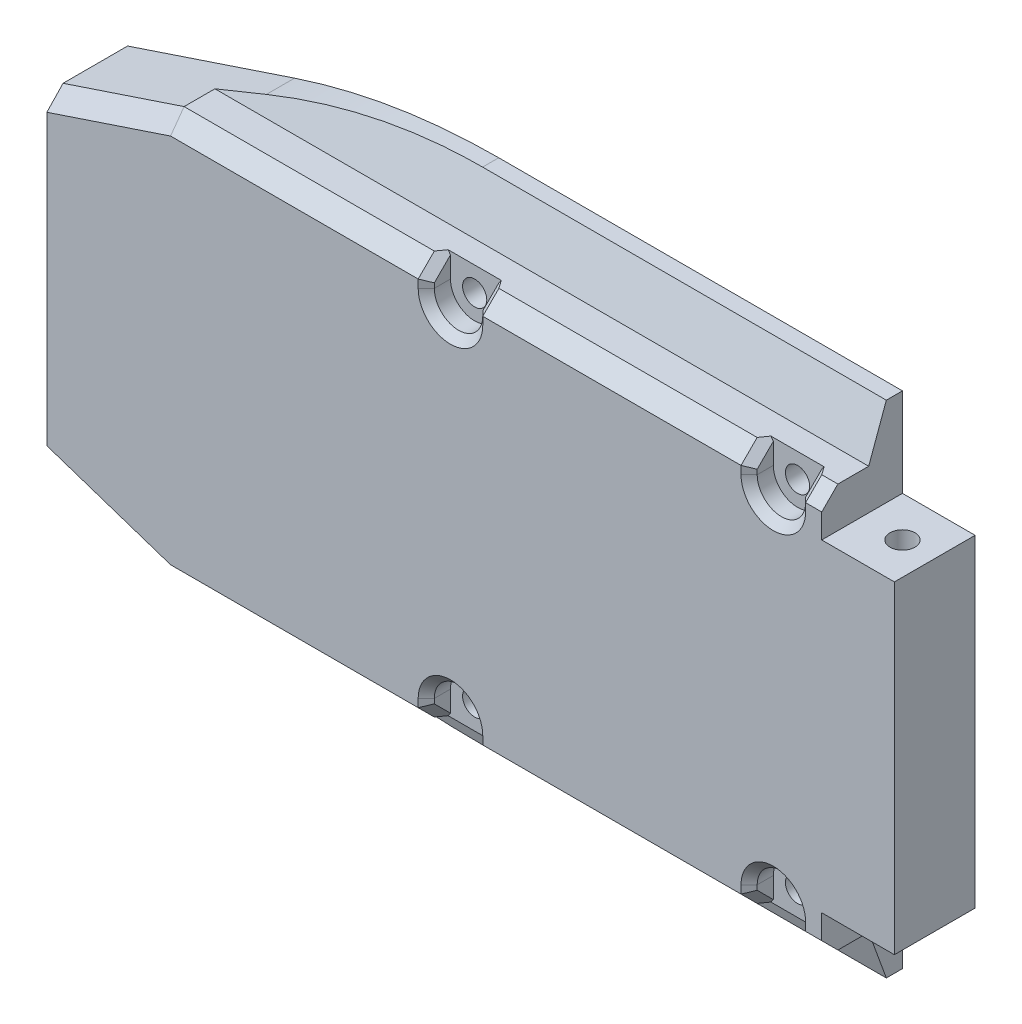
from build123d import *

# Parameters (mm, degrees)
AUFSATZ_LINEAR_AUSTRAGEN1_DEPTH      = 5
AUFSATZ_LINEAR_AUSTRAGEN1_DEPTH_BACK = 5
F_3_1_3_1_DURCHMESSER_BOHRUNG1_D     = 3.1
F_3_1_3_1_DURCHMESSER_BOHRUNG1_DEPTH = 8
F_3_1_3_1_DURCHMESSER_BOHRUNG1_TIP   = 0.931333959
SCHNITT_LINEAR_AUSTRAGEN1_DEPTH      = 109.050913925
SCHNITT_LINEAR_AUSTRAGEN1_DEPTH_BACK = 109.050913925
SKIZZE5_R                            = 1.5
SCHNITT_LINEAR_AUSTRAGEN2_DEPTH      = 3
SCHNITT_LINEAR_AUSTRAGEN3_DEPTH      = 109.397416943
SCHNITT_LINEAR_AUSTRAGEN3_DEPTH_BACK = 109.397416943
SKIZZE7_W                            = 9
SKIZZE7_H                            = 5
SCHNITT_LINEAR_AUSTRAGEN4_DEPTH      = 4
SCHNITT_LINEAR_AUSTRAGEN4_DEPTH_BACK = 109.050913925
AUFSATZ_LINEAR_AUSTRAGEN2_DEPTH      = 2
FASE1_SIZE2                          = 6
FASE1_SIZE                           = 2.183821406
FASE2_SIZE2                          = 6
FASE2_SIZE                           = 2.183821406
VERRUNDUNG1_R                        = 80
VERRUNDUNG2_R                        = 2
SKIZZE12_W                           = 10
SKIZZE12_H                           = 22
AUFSATZ_LINEAR_AUSTRAGEN3_DEPTH      = 1
FASE3_SIZE                           = 2
SCHNITT_LINEAR_AUSTRAGEN5_REACH      = 111.936
FASE4_SIZE                           = 1


# Some blends are built 0.0001 mm under size
with BuildPart() as part:
    # Skizze2 → Aufsatz-Linear austragen1 (new, two sides: drawn at the far end of the back side and taken through both)
    with BuildSketch(Plane.XY.offset(-AUFSATZ_LINEAR_AUSTRAGEN1_DEPTH_BACK)):
        with BuildLine():
            Line((0, 25), (-90, 25))
            Line((-90, 25), (-105, 20))
            Line((-105, 20), (-105, 11))
            Line((-105, 11), (-98, 11))
            ThreePointArc((-98, 11), (-95.878679656, 10.121320344), (-95, 8))
            Line((-95, 8), (-95, -8))
            ThreePointArc((-95, -8), (-95.878679656, -10.121320344), (-98, -11))
            Line((-98, -11), (-105, -11))
            Line((-105, -11), (-105, -20))
            Line((-105, -20), (-90, -25))
            Line((-90, -25), (0, -25))
            Line((0, -25), (0, 25))
        make_face()
    extrude(amount=AUFSATZ_LINEAR_AUSTRAGEN1_DEPTH + AUFSATZ_LINEAR_AUSTRAGEN1_DEPTH_BACK)

    # Ø3.1 (3.1) Durchmesser Bohrung1
    with Locations(Plane.ZY.offset(105)):
        with Locations((0, 15), (0, -15)):
            Hole(F_3_1_3_1_DURCHMESSER_BOHRUNG1_D / 2, depth=F_3_1_3_1_DURCHMESSER_BOHRUNG1_DEPTH)
            with Locations((0, 0, -(F_3_1_3_1_DURCHMESSER_BOHRUNG1_DEPTH + F_3_1_3_1_DURCHMESSER_BOHRUNG1_TIP / 2))):  # 118° drill point
                Cone(0, F_3_1_3_1_DURCHMESSER_BOHRUNG1_D / 2, F_3_1_3_1_DURCHMESSER_BOHRUNG1_TIP, mode=Mode.SUBTRACT)

    # Skizze5 → Schnitt-Linear austragen1 (cut, two sides: drawn at the far end of the back side and taken through both)
    with BuildSketch(Plane.XY.offset(-SCHNITT_LINEAR_AUSTRAGEN1_DEPTH_BACK)):
        with Locations((-55, 22)):
            Circle(SKIZZE5_R)
        with Locations((-15, 22)):
            Circle(SKIZZE5_R)
        with Locations(Location((-15, -22, 0), (0, 0, 180))):
            Circle(SKIZZE5_R)
        with Locations(Location((-55, -22, 0), (0, 0, 180))):
            Circle(SKIZZE5_R)
    extrude(amount=SCHNITT_LINEAR_AUSTRAGEN1_DEPTH + SCHNITT_LINEAR_AUSTRAGEN1_DEPTH_BACK, mode=Mode.SUBTRACT)

    # Skizze6 → Schnitt-Linear austragen2 (cut)
    with BuildSketch(Plane.XY.offset(5)):
        with BuildLine():
            Line((-58, 22), (-58, 29.262582446))
            ThreePointArc((-58, 29.262582446), (-55, 32.262582446), (-52, 29.262582446))
            Line((-52, 29.262582446), (-52, 22))
            ThreePointArc((-52, 22), (-55, 19), (-58, 22))
        make_face()
        with BuildLine():
            Line((-18, 22), (-18, 29.262582446))
            ThreePointArc((-18, 29.262582446), (-15, 32.262582446), (-12, 29.262582446))
            Line((-12, 29.262582446), (-12, 22))
            ThreePointArc((-12, 22), (-15, 19), (-18, 22))
        make_face()
        with BuildLine():
            Line((-52, -22), (-52, -29.780690507))
            ThreePointArc((-52, -29.780690507), (-55, -32.780690507), (-58, -29.780690507))
            Line((-58, -29.780690507), (-58, -22))
            ThreePointArc((-58, -22), (-55, -19), (-52, -22))
        make_face()
        with BuildLine():
            Line((-12, -22), (-12, -30.84862117))
            ThreePointArc((-12, -30.84862117), (-15, -33.84862117), (-18, -30.84862117))
            Line((-18, -30.84862117), (-18, -22))
            ThreePointArc((-18, -22), (-15, -19), (-12, -22))
        make_face()
    extrude(amount=-SCHNITT_LINEAR_AUSTRAGEN2_DEPTH, mode=Mode.SUBTRACT)

    # Skizze7 → Schnitt-Linear austragen3 (cut, two sides: drawn at the far end of the back side and taken through both)
    with BuildSketch(Plane.XY.offset(5).offset(-SCHNITT_LINEAR_AUSTRAGEN3_DEPTH_BACK)):
        with Locations((-4.5, 22.5)):
            Rectangle(SKIZZE7_W, SKIZZE7_H)
        with Locations((-4.5, -22.5)):
            Rectangle(SKIZZE7_W, SKIZZE7_H)
    extrude(amount=SCHNITT_LINEAR_AUSTRAGEN3_DEPTH + SCHNITT_LINEAR_AUSTRAGEN3_DEPTH_BACK, mode=Mode.SUBTRACT)

    # Skizze8 → Schnitt-Linear austragen4 (cut, two sides: drawn at the far end of the back side and taken through both)
    with BuildSketch(Plane.XY.offset(-SCHNITT_LINEAR_AUSTRAGEN4_DEPTH_BACK)):
        with BuildLine():
            Line((-51, -22), (-19, -22))
            ThreePointArc((-19, -22), (-17.828427125, -19.171572875), (-15, -18))
            Line((-15, -18), (-7, -18))
            Line((-7, -18), (-7, 18))
            Line((-7, 18), (-15, 18))
            ThreePointArc((-15, 18), (-17.828427125, 19.171572875), (-19, 22))
            Line((-19, 22), (-51, 22))
            ThreePointArc((-51, 22), (-51.83772234, 19.550510257), (-54, 18.127016654))
            Line((-54, 18.127016654), (-54, -18.127016654))
            ThreePointArc((-54, -18.127016654), (-51.83772234, -19.550510257), (-51, -22))
        make_face()
        with BuildLine():
            Line((-56, 18.127016654), (-56, -18.127016654))
            ThreePointArc((-56, -18.127016654), (-58.16227766, -19.550510257), (-59, -22))
            Line((-59, -22), (-89.513167019, -22))
            Line((-89.513167019, -22), (-93, -20.83772234))
            Line((-93, -20.83772234), (-93, 20.83772234))
            Line((-93, 20.83772234), (-89.513167019, 22))
            Line((-89.513167019, 22), (-59, 22))
            ThreePointArc((-59, 22), (-58.16227766, 19.550510257), (-56, 18.127016654))
        make_face()
    extrude(amount=SCHNITT_LINEAR_AUSTRAGEN4_DEPTH + SCHNITT_LINEAR_AUSTRAGEN4_DEPTH_BACK, mode=Mode.SUBTRACT)

    # Skizze9 → Aufsatz-Linear austragen2 (add)
    with BuildSketch(Plane(origin=(0, 0, -5), x_dir=(-1, 0, 0), z_dir=(0, 0, -1))):
        Polygon((9, 25), (9, 31), (72, 31), (90, 25), align=None)
        Polygon((9, -25), (90, -25), (72, -31), (9, -31), align=None)
    extrude(amount=-AUFSATZ_LINEAR_AUSTRAGEN2_DEPTH)

    # Skizze10 → Ø3.1 (3.1) Durchmesser Bohrung2 (revolve, cut)
    with BuildSketch(Plane(origin=(-4, 20, 0), x_dir=(0, 0, 1), z_dir=(1, 0, 0))):
        Polygon((0, 0), (0, 10.931333959), (1.55, 10), (1.55, 0), align=None)
    f_3_1_3_1_durchmesser_bohrung2 = revolve(axis=Axis((-4, 26.35, 0), (0, -1, 0)), mode=Mode.SUBTRACT)

    # Spiegeln1: Ø3.1 (3.1) Durchmesser Bohrung2 across plane
    add(f_3_1_3_1_durchmesser_bohrung2.mirror(Plane.ZX), mode=Mode.SUBTRACT)

    # Fase1
    fase1_edges = [part.edges().sort_by_distance(p)[0] for p in [
        (-49.5, 25, -3),
    ]]
    fase1_side = [part.faces().sort_by_distance(p)[0] for p in [
        (-49.5, 25, -2.956323572),
    ]]
    chamfer(fase1_edges, length=FASE1_SIZE - 0.0001, length2=FASE1_SIZE2 - 0.0001, reference=fase1_side[0])  # a hair under: the kernel refuses the full size

    # Fase2
    fase2_edges = [part.edges().sort_by_distance(p)[0] for p in [
        (-49.5, -25, -3),
    ]]
    fase2_side = [part.faces().sort_by_distance(p)[0] for p in [
        (-49.5, -25, -2.956323572),
    ]]
    chamfer(fase2_edges, length=FASE2_SIZE - 0.0001, length2=FASE2_SIZE2 - 0.0001, reference=fase2_side[0])  # a hair under: the kernel refuses the full size

    # Verrundung1
    verrundung1_edges = [part.edges().sort_by_distance(p)[0] for p in [
        (-72, 31, -4),
        (-72, -31, -4),
    ]]
    fillet(verrundung1_edges, radius=VERRUNDUNG1_R)

    # Verrundung2
    verrundung2_edges = [part.edges().sort_by_distance(p)[0] for p in [
        (-19, 22, -0.5),
        (-51, 22, -0.5),
        (-54, 18.127016654, -0.5),
        (-54, -18.127016654, -0.5),
        (-51, -22, -0.5),
        (-19, -22, -0.5),
        (-7, -18, -0.5),
        (-7, 18, -0.5),
        (-59, -22, -0.5),
        (-56, -18.127016654, -0.5),
        (-56, 18.127016654, -0.5),
        (-59, 22, -0.5),
        (-93, 20.83772234, -0.5),
        (-93, -20.83772234, -0.5),
    ]]
    fillet(verrundung2_edges, radius=VERRUNDUNG2_R)

    # Skizze12 → Aufsatz-Linear austragen3 (add)
    with BuildSketch(Plane.XY.offset(5)):
        with Locations((-100, 0)):
            Rectangle(SKIZZE12_W, SKIZZE12_H)
    extrude(amount=-AUFSATZ_LINEAR_AUSTRAGEN3_DEPTH)

    # Fase3
    fase3_edges = [part.edges().sort_by_distance(p)[0] for p in [
        (-10.5, 25, 5),
        (-97.5, 22.5, 5),
        (-97.5, -22.5, 5),
        (-74, -25, 5),
        (-35, 25, 5),
        (-74, 25, 5),
        (-35, -25, 5),
        (-10.5, -25, 5),
    ]]
    chamfer(fase3_edges, length=FASE3_SIZE)

    # Schnitt-Linear austragen5: up to this face of the body (flat: up to its plane)
    schnitt_linear_austragen5_end = Plane(part.part.faces().sort_by_distance((-31.128414166, 0, 4))[0])
    # Skizze13 → Schnitt-Linear austragen5 (cut, up to the picked face)
    with BuildSketch(Plane(origin=(0, 0, -5), x_dir=(-1, 0, 0), z_dir=(0, 0, -1)), mode=Mode.PRIVATE) as schnitt_linear_austragen5_sk1:
        with BuildLine():
            Line((5.5, 10), (5.5, -10))
            ThreePointArc((5.5, -10), (4, -11.5), (2.5, -10))
            Line((2.5, -10), (2.5, 10))
            ThreePointArc((2.5, 10), (4, 11.5), (5.5, 10))
        make_face()
    schnitt_linear_austragen5_tool1 = split(extrude(schnitt_linear_austragen5_sk1.sketch, amount=-SCHNITT_LINEAR_AUSTRAGEN5_REACH, mode=Mode.PRIVATE), bisect_by=schnitt_linear_austragen5_end, keep=Keep.BOTH, mode=Mode.PRIVATE)
    add(schnitt_linear_austragen5_tool1.solids().sort_by(Axis((-4, 0, -5), (0, 0, 1)))[0], mode=Mode.SUBTRACT)

    # Fase4
    # the kernel refuses this chamfer: 1 mm, written as the material it takes off along each edge
    with BuildSketch(Plane(origin=(-12, -21.18154552, 6.81845448), x_dir=(0.9996219169112968, -0.01944252080601341, 0.01944252080601341), z_dir=(0, -0.7071067811865476, -0.7071067811865476))) as fase4_piece_1_section:
        Polygon((FASE4_SIZE * 0.999621916911, -FASE4_SIZE * 0.0274958766106), (-FASE4_SIZE * 0.0274958766106, -FASE4_SIZE * 0.999621916911), (0, 0), align=None)
    fase4_piece_1 = extrude(amount=7.971793101, mode=Mode.PRIVATE)
    fase4_piece_1 = split(fase4_piece_1, bisect_by=Plane(origin=(-11.681385886, -23.736257989, 2), z_dir=(0, 0, 1)), keep=Keep.TOP, mode=Mode.PRIVATE)
    add(fase4_piece_1, mode=Mode.SUBTRACT)
    with BuildSketch(Plane(origin=(-18, -21.18154552, 6.81845448), x_dir=(0.027495876610585647, 0.7068394360706736, -0.7068394360706736), z_dir=(0, -0.7071067811865476, -0.7071067811865476))) as fase4_piece_2_section:
        Polygon((FASE4_SIZE * 0.999621916911, -FASE4_SIZE * 0.0274958766106), (-FASE4_SIZE * 0.0274958766106, -FASE4_SIZE * 0.999621916911), (0, 0), align=None)
    fase4_piece_2 = extrude(amount=7.971793101, mode=Mode.PRIVATE)
    fase4_piece_2 = split(fase4_piece_2, bisect_by=Plane(origin=(-18.318614114, -23.736257989, 2), z_dir=(0, 0, 1)), keep=Keep.TOP, mode=Mode.PRIVATE)
    add(fase4_piece_2, mode=Mode.SUBTRACT)
    with BuildSketch(Plane(origin=(-12, -22, 5), x_dir=(0.9996219169112968, 0, 0.027495876610586414), z_dir=(0, -1, 0)), Plane(origin=(-18, -25.571682988, 5), x_dir=(-0.9996219169112968, 0, 0.02749587661058651), z_dir=(0, 1, 0)), Plane(origin=(-58, 22, 5), x_dir=(-0.9996219169112968, 0, 0.027495876610586414), z_dir=(0, 1, 0)), Plane(origin=(-52, 25.571682988, 5), x_dir=(0.9996219169112968, 0, 0.027495876610586414), z_dir=(0, -1, 0)), Plane(origin=(-12, 25.571682988, 5), x_dir=(0.9996219169112968, 0, 0.02749587661058651), z_dir=(0, -1, 0)), Plane(origin=(-52, -22, 5), x_dir=(0.9996219169112968, 0, 0.027495876610586414), z_dir=(0, -1, 0)), Plane(origin=(-58, -25.571682988, 5), x_dir=(-0.9996219169112968, 0, 0.027495876610586414), z_dir=(0, 1, 0))) as fase4_piece_3:
        Polygon((FASE4_SIZE * 0.999621916911, -FASE4_SIZE * 0.0274958766106), (-FASE4_SIZE * 0.0274958766106, -FASE4_SIZE * 0.999621916911), (0, 0), align=None)
    extrude(amount=3.571682988, mode=Mode.SUBTRACT)
    with BuildSketch(Plane(origin=(-15, -22, 5), x_dir=(-1, 0, 0), z_dir=(0, -1, 0))) as fase4_piece_4:
        Polygon((3 + FASE4_SIZE, 0), (3, FASE4_SIZE), (3, 0), align=None)
    revolve(axis=Axis((-15, -22, 5), (0, 0, -1)), revolution_arc=180, mode=Mode.SUBTRACT)
    with BuildSketch(Plane(origin=(-58, 21.18154552, 6.81845448), x_dir=(0.027495876610589096, -0.7068394360706733, -0.7068394360706733), z_dir=(0, 0.7071067811865476, -0.7071067811865476))) as fase4_piece_5_section:
        Polygon((FASE4_SIZE * 0.999621916911, FASE4_SIZE * 0.0274958766106), (-FASE4_SIZE * 0.0274958766106, FASE4_SIZE * 0.999621916911), (0, 0), align=None)
    fase4_piece_5 = extrude(amount=7.971793101, mode=Mode.PRIVATE)
    fase4_piece_5 = split(fase4_piece_5, bisect_by=Plane(origin=(-58.318614114, 23.736257989, 2), z_dir=(0, 0, 1)), keep=Keep.TOP, mode=Mode.PRIVATE)
    add(fase4_piece_5, mode=Mode.SUBTRACT)
    with BuildSketch(Plane(origin=(-52, 21.18154552, 6.81845448), x_dir=(0.9996219169112965, 0.019442520806015894, 0.019442520806015894), z_dir=(0, 0.7071067811865476, -0.7071067811865476))) as fase4_piece_6_section:
        Polygon((FASE4_SIZE * 0.999621916911, FASE4_SIZE * 0.0274958766106), (-FASE4_SIZE * 0.0274958766106, FASE4_SIZE * 0.999621916911), (0, 0), align=None)
    fase4_piece_6 = extrude(amount=7.971793101, mode=Mode.PRIVATE)
    fase4_piece_6 = split(fase4_piece_6, bisect_by=Plane(origin=(-51.681385886, 23.736257989, 2), z_dir=(0, 0, 1)), keep=Keep.TOP, mode=Mode.PRIVATE)
    add(fase4_piece_6, mode=Mode.SUBTRACT)
    with BuildSketch(Plane(origin=(-55, 22, 5), x_dir=(1, 0, 0), z_dir=(0, 1, 0))) as fase4_piece_7:
        Polygon((3 + FASE4_SIZE, 0), (3, FASE4_SIZE), (3, 0), align=None)
    revolve(axis=Axis((-55, 22, 5), (0, 0, -1)), revolution_arc=180, mode=Mode.SUBTRACT)
    with BuildSketch(Plane(origin=(-18, 21.18154552, 6.81845448), x_dir=(0.027495876610585664, -0.7068394360706736, -0.7068394360706736), z_dir=(0, 0.7071067811865476, -0.7071067811865476))) as fase4_piece_8_section:
        Polygon((FASE4_SIZE * 0.999621916911, FASE4_SIZE * 0.0274958766106), (-FASE4_SIZE * 0.0274958766106, FASE4_SIZE * 0.999621916911), (0, 0), align=None)
    fase4_piece_8 = extrude(amount=7.971793101, mode=Mode.PRIVATE)
    fase4_piece_8 = split(fase4_piece_8, bisect_by=Plane(origin=(-18.318614114, 23.736257989, 2), z_dir=(0, 0, 1)), keep=Keep.TOP, mode=Mode.PRIVATE)
    add(fase4_piece_8, mode=Mode.SUBTRACT)
    with BuildSketch(Plane(origin=(-12, 21.18154552, 6.81845448), x_dir=(0.9996219169112968, 0.019442520806015103, 0.019442520806015103), z_dir=(0, 0.7071067811865476, -0.7071067811865476))) as fase4_piece_9_section:
        Polygon((FASE4_SIZE * 0.999621916911, FASE4_SIZE * 0.0274958766106), (-FASE4_SIZE * 0.0274958766106, FASE4_SIZE * 0.999621916911), (0, 0), align=None)
    fase4_piece_9 = extrude(amount=7.971793101, mode=Mode.PRIVATE)
    fase4_piece_9 = split(fase4_piece_9, bisect_by=Plane(origin=(-11.681385886, 23.736257989, 2), z_dir=(0, 0, 1)), keep=Keep.TOP, mode=Mode.PRIVATE)
    add(fase4_piece_9, mode=Mode.SUBTRACT)
    with BuildSketch(Plane(origin=(-18, 22, 5), x_dir=(0.027495876610585623, 0, -0.9996219169112968), z_dir=(0, 1, 0))) as fase4_piece_10:
        Polygon((FASE4_SIZE * 0.999621916911, FASE4_SIZE * 0.0274958766106), (-FASE4_SIZE * 0.0274958766106, FASE4_SIZE * 0.999621916911), (0, 0), align=None)
    extrude(amount=3.571682988, mode=Mode.SUBTRACT)
    with BuildSketch(Plane(origin=(-15, 22, 5), x_dir=(1, 0, 0), z_dir=(0, 1, 0))) as fase4_piece_11:
        Polygon((3 + FASE4_SIZE, 0), (3, FASE4_SIZE), (3, 0), align=None)
    revolve(axis=Axis((-15, 22, 5), (0, 0, -1)), revolution_arc=180, mode=Mode.SUBTRACT)
    with BuildSketch(Plane(origin=(-55, -22, 5), x_dir=(-1, 0, 0), z_dir=(0, -1, 0))) as fase4_piece_12:
        Polygon((3 + FASE4_SIZE, 0), (3, FASE4_SIZE), (3, 0), align=None)
    revolve(axis=Axis((-55, -22, 5), (0, 0, -1)), revolution_arc=180, mode=Mode.SUBTRACT)
    with BuildSketch(Plane(origin=(-58, -21.18154552, 6.81845448), x_dir=(0.027495876610589113, 0.7068394360706735, -0.7068394360706735), z_dir=(0, -0.7071067811865476, -0.7071067811865476))) as fase4_piece_13_section:
        Polygon((FASE4_SIZE * 0.999621916911, -FASE4_SIZE * 0.0274958766106), (-FASE4_SIZE * 0.0274958766106, -FASE4_SIZE * 0.999621916911), (0, 0), align=None)
    fase4_piece_13 = extrude(amount=7.971793101, mode=Mode.PRIVATE)
    fase4_piece_13 = split(fase4_piece_13, bisect_by=Plane(origin=(-58.318614114, -23.736257989, 2), z_dir=(0, 0, 1)), keep=Keep.TOP, mode=Mode.PRIVATE)
    add(fase4_piece_13, mode=Mode.SUBTRACT)
    with BuildSketch(Plane(origin=(-52, -21.18154552, 6.81845448), x_dir=(0.9996219169112965, -0.019442520806015894, 0.019442520806015894), z_dir=(0, -0.7071067811865476, -0.7071067811865476))) as fase4_piece_14_section:
        Polygon((FASE4_SIZE * 0.999621916911, -FASE4_SIZE * 0.0274958766106), (-FASE4_SIZE * 0.0274958766106, -FASE4_SIZE * 0.999621916911), (0, 0), align=None)
    fase4_piece_14 = extrude(amount=7.971793101, mode=Mode.PRIVATE)
    fase4_piece_14 = split(fase4_piece_14, bisect_by=Plane(origin=(-51.681385886, -23.736257989, 2), z_dir=(0, 0, 1)), keep=Keep.TOP, mode=Mode.PRIVATE)
    add(fase4_piece_14, mode=Mode.SUBTRACT)


solid = part.part
